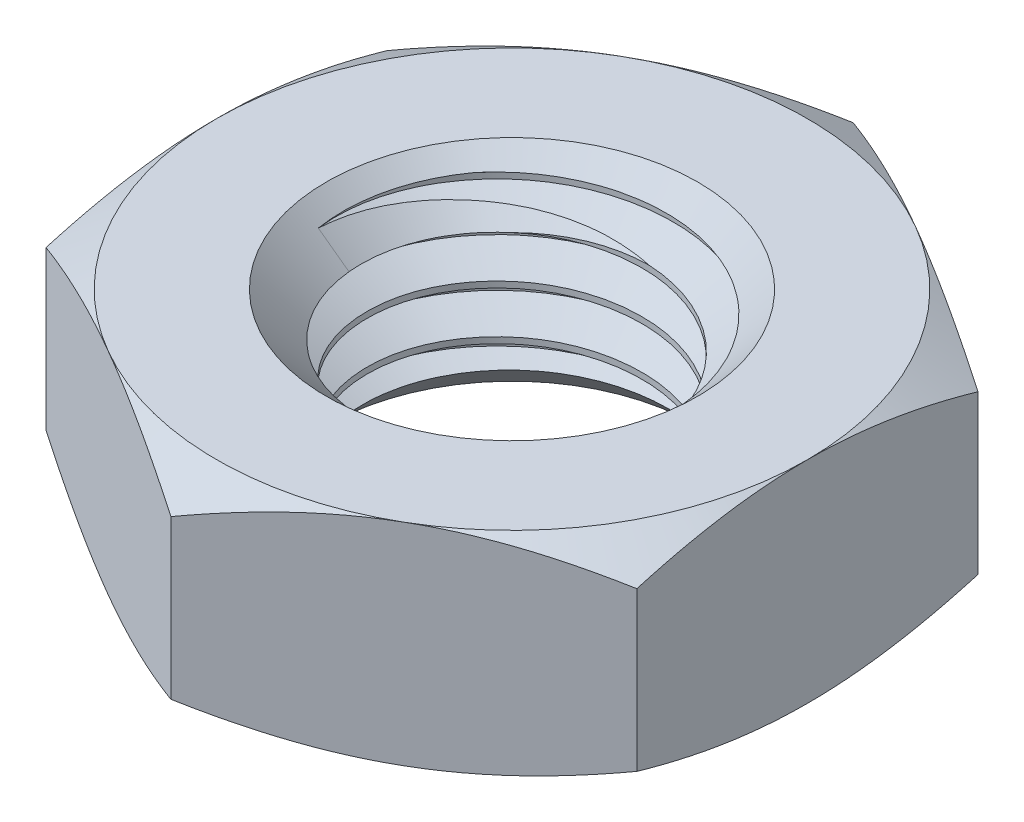
from build123d import *
from build123d.topology import SkipClean

# Parameters (mm, degrees)
BOSS_EXTRUDE1_DEPTH      = 1.984375
BOSS_EXTRUDE1_DEPTH_BACK = 1.984375
SKETCH2_R                = 3.175
SKETCH4_R                = 3.175
BOSS_EXTRUDE2_DEPTH      = 3.96875
CUT_SWEEP1_PITCH         = 0.907142857
SKETCH8_R                = 3.4925
BOSS_EXTRUDE3_DEPTH      = 3.96875


with BuildPart() as part:
    # Sketch2 → Boss-Extrude1 (new, two sides: drawn at the far end of the back side and taken through both)
    with BuildSketch(Plane(origin=(0, 0, 0), x_dir=(1, 0, 0), z_dir=(0, 1, 0)).offset(-BOSS_EXTRUDE1_DEPTH_BACK)):
        Polygon((0, 6.415804866), (-5.55625, 3.207902433), (-5.55625, -3.207902433), (0, -6.415804866), (5.55625, -3.207902433), (5.55625, 3.207902433), align=None)
        with Locations(Location((0, 0, 0), (0, 0, 270))):
            Circle(SKETCH2_R, mode=Mode.SUBTRACT)
    extrude(amount=BOSS_EXTRUDE1_DEPTH + BOSS_EXTRUDE1_DEPTH_BACK)

    # Sketch3 → Cut-Revolve1 (revolve, cut)
    with BuildSketch(Plane(origin=(0, 0, 0), x_dir=(0, 0, -1), z_dir=(1, 0, 0))):
        Polygon((-6.415804866, 1.488110767), (-5.55625, 1.984375), (-6.415804866, 1.984375), align=None)
        Polygon((-6.415804866, -1.488110767), (-5.55625, -1.984375), (-6.415804866, -1.984375), align=None)
        Polygon((-3.4925, 1.984375), (-3.175, 1.984375), (-3.175, 1.666875), align=None)
        Polygon((-3.4925, -1.984375), (-3.175, -1.984375), (-3.175, -1.666875), align=None)
    revolve(axis=Axis((0, 1.984375, 0), (0, -1, 0)), mode=Mode.SUBTRACT)

    # Sketch8 → Boss-Extrude3 (add)
    with BuildSketch(Plane(origin=(0, 1.984375, 0), x_dir=(1, 0, 0), z_dir=(0, 1, 0))):
        Circle(SKETCH8_R)
    extrude(amount=-BOSS_EXTRUDE3_DEPTH)


with BuildPart() as body_2:
    # Sketch4 → Boss-Extrude2 (new body)
    with BuildSketch(Plane(origin=(0, 1.984375, 0), x_dir=(1, 0, 0), z_dir=(0, 1, 0))):
        with Locations(Location((0, 0, 0), (0, 0, 270))):
            Circle(SKETCH4_R)
    extrude(amount=-BOSS_EXTRUDE2_DEPTH)

    # Cut-Sweep1: the profile of Sketch6 screwed along a right-hand helix of 5.375 turns, 8 arcs to a turn; built about Z, then put on its axis
    cut_sweep1_z = Axis((0, 0, 0), (0, 0, 1))
    cut_sweep1_corners = [(3.224100547, 0, 0.028348214), (3.224100547, 0, -0.822098214), (2.585793431, 0, -0.453571429), (2.585793431, 0, -0.340178571)]
    with BuildLine(mode=Mode.PRIVATE) as cut_sweep1_profile:
        Line(cut_sweep1_corners[0], cut_sweep1_corners[1])
        Line(cut_sweep1_corners[1], cut_sweep1_corners[2])
        Line(cut_sweep1_corners[2], cut_sweep1_corners[3])
        Line(cut_sweep1_corners[3], cut_sweep1_corners[0])
    cut_sweep1_cap = Face(cut_sweep1_profile.wire())
    cut_sweep1_turn_angles = [0, 22.5, 45, 67.5, 90, 112.5, 135, 157.5, 180, 202.5, 225, 247.5, 270, 292.5, 315, 337.5, 360]
    cut_sweep1_turn_weights = [1, 0.9238795325112867, 1, 0.9238795325112867, 1, 0.9238795325112867, 1, 0.9238795325112867, 1, 0.9238795325112867, 1, 0.9238795325112867, 1, 0.9238795325112867, 1, 0.9238795325112867, 1]
    cut_sweep1_turn_rails = [Edge.make_bspline([Vector(p[0], p[1], 0).rotate(cut_sweep1_z, cut_sweep1_turn_angles[k]) / cut_sweep1_turn_weights[k] + Vector(0, 0, p[2] + CUT_SWEEP1_PITCH * cut_sweep1_turn_angles[k] / 360) for k in range(17)], [0, 0, 0, 1, 1, 2, 2, 3, 3, 4, 4, 5, 5, 6, 6, 7, 7, 8, 8, 8], 2, cut_sweep1_turn_weights) for p in cut_sweep1_corners]
    cut_sweep1_turn_sides = [Face.make_surface_from_curves(cut_sweep1_turn_rails[p[0]], cut_sweep1_turn_rails[p[1]]) for p in [(0, 1), (1, 2), (2, 3), (3, 0)]]
    cut_sweep1_last_angles = [1800, 1822.5, 1845, 1867.5, 1890, 1912.5, 1935]
    cut_sweep1_last_weights = [1, 0.9238795325112867, 1, 0.9238795325112867, 1, 0.9238795325113233, 1]
    cut_sweep1_last_rails = [Edge.make_bspline([Vector(p[0], p[1], 0).rotate(cut_sweep1_z, cut_sweep1_last_angles[k]) / cut_sweep1_last_weights[k] + Vector(0, 0, p[2] + CUT_SWEEP1_PITCH * cut_sweep1_last_angles[k] / 360) for k in range(7)], [0, 0, 0, 1, 1, 2, 2, 3, 3, 3], 2, cut_sweep1_last_weights) for p in cut_sweep1_corners]
    cut_sweep1_last_sides = [Face.make_surface_from_curves(cut_sweep1_last_rails[p[0]], cut_sweep1_last_rails[p[1]]) for p in [(0, 1), (1, 2), (2, 3), (3, 0)]]
    cut_sweep1 = Plane(origin=(0, 1.984375, 0), x_dir=(0, 0, 1), z_dir=(0, -1, 0)) * Solid(Shell([*[p.moved(Location((0, 0, CUT_SWEEP1_PITCH * i))) for i in range(5) for p in cut_sweep1_turn_sides], *cut_sweep1_last_sides, cut_sweep1_cap, cut_sweep1_cap.rotate(cut_sweep1_z, 1935).moved(Location((0, 0, CUT_SWEEP1_PITCH * 1935 / 360)))]))
    add(cut_sweep1, mode=Mode.SUBTRACT)

    # Sketch7 → Revolve1 (revolve)
    with SkipClean():  # the faces are left unmerged after this step: merging them gives an invalid solid
        with BuildSketch(Plane(origin=(0, 0, 0), x_dir=(0, 0, -1), z_dir=(1, 0, 0)), mode=Mode.PRIVATE) as revolve1_sk:
            Polygon((-3.4925, 1.984375), (-1.905, 0.396875), (0, 0.396875), (0, 1.984375), align=None)
            Polygon((-3.4925, -1.984375), (0, -1.984375), (0, -0.396875), (-1.905, -0.396875), align=None)
        revolve(revolve1_sk.sketch.rotate(Axis((0, -1.984375, 0), (0, 1, 0)), 279.22588459), axis=Axis((0, -1.984375, 0), (0, 1, 0)))


with BuildPart() as part_1:
    add(part.part)

    # Combine1: cut body 2
    add(body_2.part, mode=Mode.SUBTRACT)


solid = part_1.part
